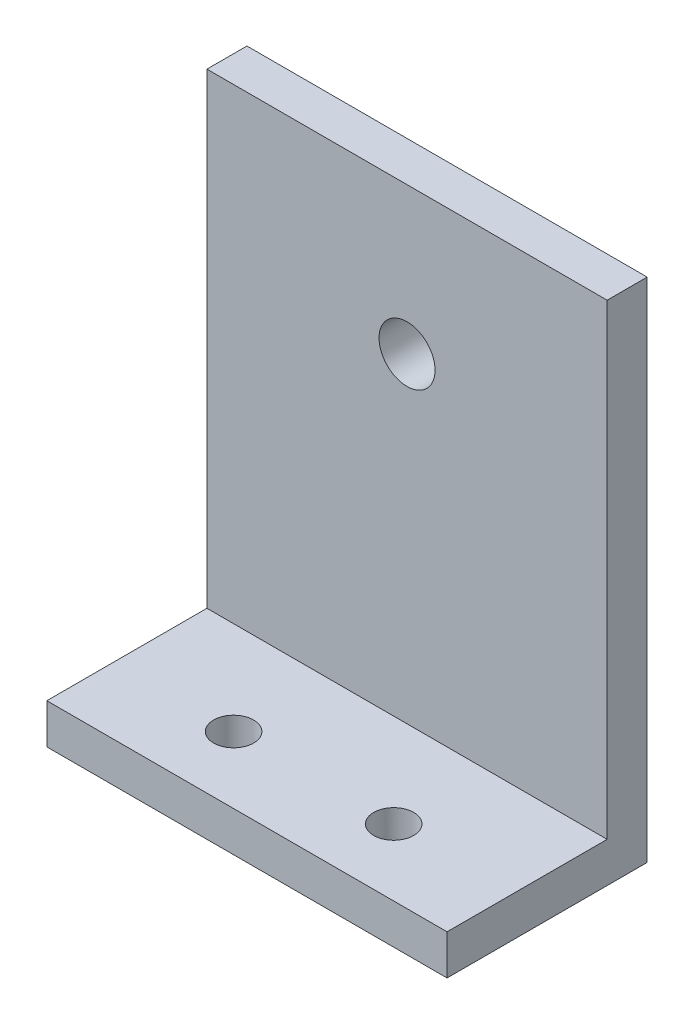
from build123d import *

# Parameters (mm, degrees)
EXTRUDE_1_DEPTH     = 30
CUT_EXTRUDE_1_REACH = 59.879
SKETCH_2_R          = 1.5
SKETCH_2_W          = 30
SKETCH_2_H          = 10
SKETCH_3_R          = 2.1
CUT_EXTRUDE_2_DEPTH = 53.440442409
SKETCH_4_W          = 30
SKETCH_4_H          = 3
CUT_EXTRUDE_3_DEPTH = 13


with BuildPart() as part:
    # 草图1 → 凸台-拉伸1 (new body)
    with BuildSketch(Plane(origin=(0, 0, 0), x_dir=(0, 0, -1), z_dir=(1, 0, 0))):
        Polygon((0, 0), (0, 35), (3, 35), (3, -3), (-35, -3), (-35, 0), align=None)
    extrude(amount=EXTRUDE_1_DEPTH)

    # 草图2 → 切除-拉伸1 (cut, up to next)
    with BuildSketch(Plane(origin=(0, 0, 0), x_dir=(1, 0, 0), z_dir=(0, 1, 0)), mode=Mode.PRIVATE) as cut_extrude_1_sk1:
        with Locations((9, -7)):
            Circle(SKETCH_2_R)
    cut_extrude_1_tool1 = extrude(cut_extrude_1_sk1.sketch, amount=-CUT_EXTRUDE_1_REACH, mode=Mode.PRIVATE) & part.part
    # 草图2 → 切除-拉伸1 (cut, up to next)
    with BuildSketch(Plane(origin=(0, 0, 0), x_dir=(1, 0, 0), z_dir=(0, 1, 0)), mode=Mode.PRIVATE) as cut_extrude_1_sk2:
        with Locations((9, -19)):
            Circle(SKETCH_2_R)
    cut_extrude_1_tool2 = extrude(cut_extrude_1_sk2.sketch, amount=-CUT_EXTRUDE_1_REACH, mode=Mode.PRIVATE) & part.part
    # 草图2 → 切除-拉伸1 (cut, up to next)
    with BuildSketch(Plane(origin=(0, 0, 0), x_dir=(1, 0, 0), z_dir=(0, 1, 0)), mode=Mode.PRIVATE) as cut_extrude_1_sk3:
        with Locations((21, -19)):
            Circle(SKETCH_2_R)
    cut_extrude_1_tool3 = extrude(cut_extrude_1_sk3.sketch, amount=-CUT_EXTRUDE_1_REACH, mode=Mode.PRIVATE) & part.part
    # 草图2 → 切除-拉伸1 (cut, up to next)
    with BuildSketch(Plane(origin=(0, 0, 0), x_dir=(1, 0, 0), z_dir=(0, 1, 0)), mode=Mode.PRIVATE) as cut_extrude_1_sk4:
        with Locations((21, -7)):
            Circle(SKETCH_2_R)
    cut_extrude_1_tool4 = extrude(cut_extrude_1_sk4.sketch, amount=-CUT_EXTRUDE_1_REACH, mode=Mode.PRIVATE) & part.part
    # 草图2 → 切除-拉伸1 (cut, up to next)
    with BuildSketch(Plane(origin=(0, 0, 0), x_dir=(1, 0, 0), z_dir=(0, 1, 0)), mode=Mode.PRIVATE) as cut_extrude_1_sk5:
        with Locations((15, -30)):
            Rectangle(SKETCH_2_W, SKETCH_2_H)
    cut_extrude_1_tool5 = extrude(cut_extrude_1_sk5.sketch, amount=-CUT_EXTRUDE_1_REACH, mode=Mode.PRIVATE) & part.part
    add(cut_extrude_1_tool1.solids().sort_by_distance((9, 0, 7))[0], mode=Mode.SUBTRACT)
    add(cut_extrude_1_tool2.solids().sort_by_distance((9, 0, 19))[0], mode=Mode.SUBTRACT)
    add(cut_extrude_1_tool3.solids().sort_by_distance((21, 0, 19))[0], mode=Mode.SUBTRACT)
    add(cut_extrude_1_tool4.solids().sort_by_distance((21, 0, 7))[0], mode=Mode.SUBTRACT)
    add(cut_extrude_1_tool5.solids().sort_by_distance((15, 0, 30))[0], mode=Mode.SUBTRACT)

    # 草图3 → 切除-拉伸2 (cut, through all)
    with BuildSketch(Plane.XY):
        with Locations((15, 24)):
            Circle(SKETCH_3_R)
    extrude(amount=-CUT_EXTRUDE_2_DEPTH, mode=Mode.SUBTRACT)

    # 草图4 → 切除-拉伸3 (cut)
    with BuildSketch(Plane.XY.offset(25)):
        with Locations((15, -1.5)):
            Rectangle(SKETCH_4_W, SKETCH_4_H)
    extrude(amount=-CUT_EXTRUDE_3_DEPTH, mode=Mode.SUBTRACT)


solid = part.part
